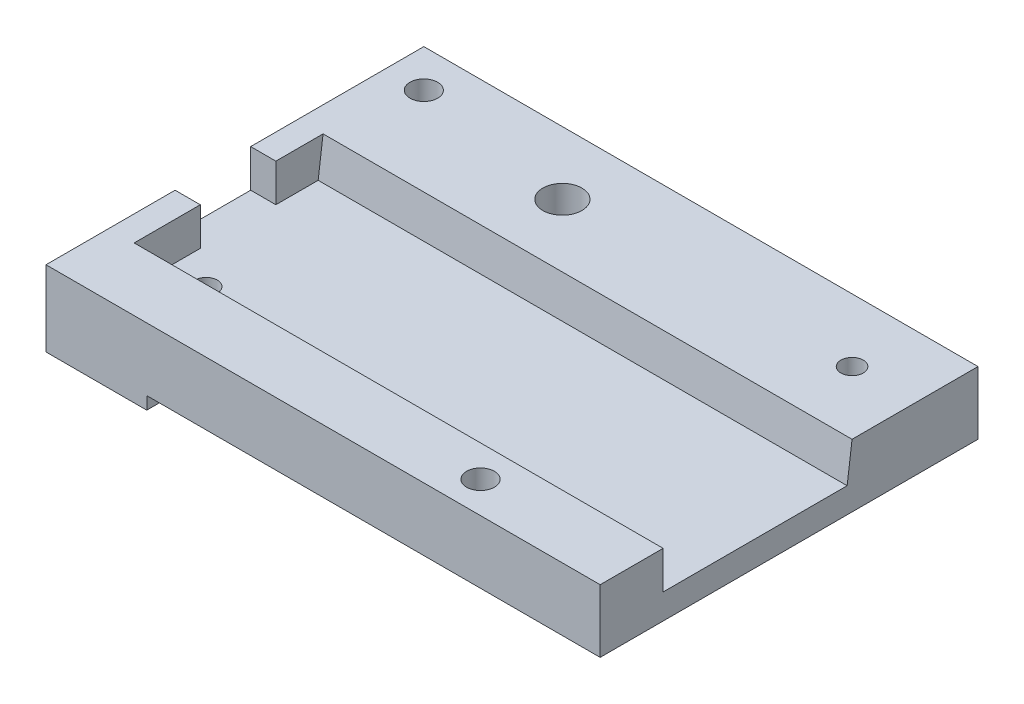
from build123d import *

# Parameters (mm, degrees)
SKETCH1_W           = 44
SKETCH1_H           = 30
BOSS_EXTRUDE1_DEPTH = 5
SKETCH2_W           = 8
SKETCH2_H           = 30
BOSS_EXTRUDE2_DEPTH = 1
SKETCH3_R           = 1.55
CUT_EXTRUDE1_DEPTH  = 28.294688128
CUT_EXTRUDE2_DEPTH  = 3
SKETCH7_R           = 1.1
CUT_EXTRUDE4_DEPTH  = 2
SKETCH5_R           = 0.889
CUT_EXTRUDE5_DEPTH  = 27.795522014
SKETCH6_R           = 0.889
CUT_EXTRUDE6_DEPTH  = 28.294688128
CHAMFER2_SIZE       = 3
CHAMFER2_SIZE_2     = 0.39


with BuildPart() as part:
    # Sketch1 → Boss-Extrude1 (new body)
    with BuildSketch(Plane(origin=(0, 0, 0), x_dir=(1, 0, 0), z_dir=(0, 1, 0))):
        Rectangle(SKETCH1_W, SKETCH1_H)
    extrude(amount=BOSS_EXTRUDE1_DEPTH)

    # Sketch2 → Boss-Extrude2 (add)
    with BuildSketch(Plane.XZ):
        with Locations((-18, 0)):
            Rectangle(SKETCH2_W, SKETCH2_H)
    extrude(amount=BOSS_EXTRUDE2_DEPTH)

    # Sketch3 → Cut-Extrude1 (cut, through all)
    with BuildSketch(Plane(origin=(0, 5, 0), x_dir=(1, 0, 0), z_dir=(0, 1, 0))):
        with Locations(Location((-6, 10, 0), (0, 0, 270))):
            Circle(SKETCH3_R)
    extrude(amount=-CUT_EXTRUDE1_DEPTH, mode=Mode.SUBTRACT)

    # Sketch4 → Cut-Extrude2 (cut)
    with BuildSketch(Plane(origin=(0, 5, 0), x_dir=(1, 0, 0), z_dir=(0, 1, 0))):
        Polygon((22, -10), (-20, -10), (-20, -4.75), (-22, -4.75), (-22, 1.25), (-20, 1.25), (-20, 5), (22, 5), align=None)
    extrude(amount=-CUT_EXTRUDE2_DEPTH, mode=Mode.SUBTRACT)

    # Sketch7 → Cut-Extrude4 (cut)
    with BuildSketch(Plane(origin=(0, 5, 0), x_dir=(1, 0, 0), z_dir=(0, 1, 0))):
        with Locations(Location((-19, 12, 0), (0, 0, 270))):
            Circle(SKETCH7_R)
        with Locations(Location((10, -12.5, 0), (0, 0, 270))):
            Circle(SKETCH7_R)
    extrude(amount=-CUT_EXTRUDE4_DEPTH, mode=Mode.SUBTRACT)

    # Sketch5 → Cut-Extrude5 (cut, through all)
    with BuildSketch(Plane(origin=(0, 2, 0), x_dir=(1, 0, 0), z_dir=(0, 1, 0))):
        with Locations(Location((-17.14, -7.14, 0), (0, 0, 270))):
            Circle(SKETCH5_R)
    extrude(amount=-CUT_EXTRUDE5_DEPTH, mode=Mode.SUBTRACT)

    # Sketch6 → Cut-Extrude6 (cut, through all)
    with BuildSketch(Plane(origin=(0, 5, 0), x_dir=(1, 0, 0), z_dir=(0, 1, 0))):
        with Locations(Location((17, 10, 0), (0, 0, 270))):
            Circle(SKETCH6_R)
    extrude(amount=-CUT_EXTRUDE6_DEPTH, mode=Mode.SUBTRACT)

    # Chamfer2
    # the kernel refuses this chamfer: 3, 0.39 mm, written as the material it adds along each edge
    with BuildSketch(Plane(origin=(-20, 2, -5), x_dir=(0, 0.9999877000722414, -0.004959808890380354), z_dir=(1, 0, 0))) as chamfer2_piece_1_section:
        Polygon((CHAMFER2_SIZE * 0.999987700072, CHAMFER2_SIZE * 0.00495980889038), (-CHAMFER2_SIZE_2 * 0.00495980889038, CHAMFER2_SIZE_2 * 0.999987700072), (0, 0), align=None)
    chamfer2_piece_1 = extrude(amount=42, mode=Mode.PRIVATE)
    chamfer2_piece_1 = split(chamfer2_piece_1, bisect_by=Plane(origin=(1, 5, -4.903199608), z_dir=(0, -1, 0)), keep=Keep.TOP, mode=Mode.PRIVATE)
    add(chamfer2_piece_1)


solid = part.part
